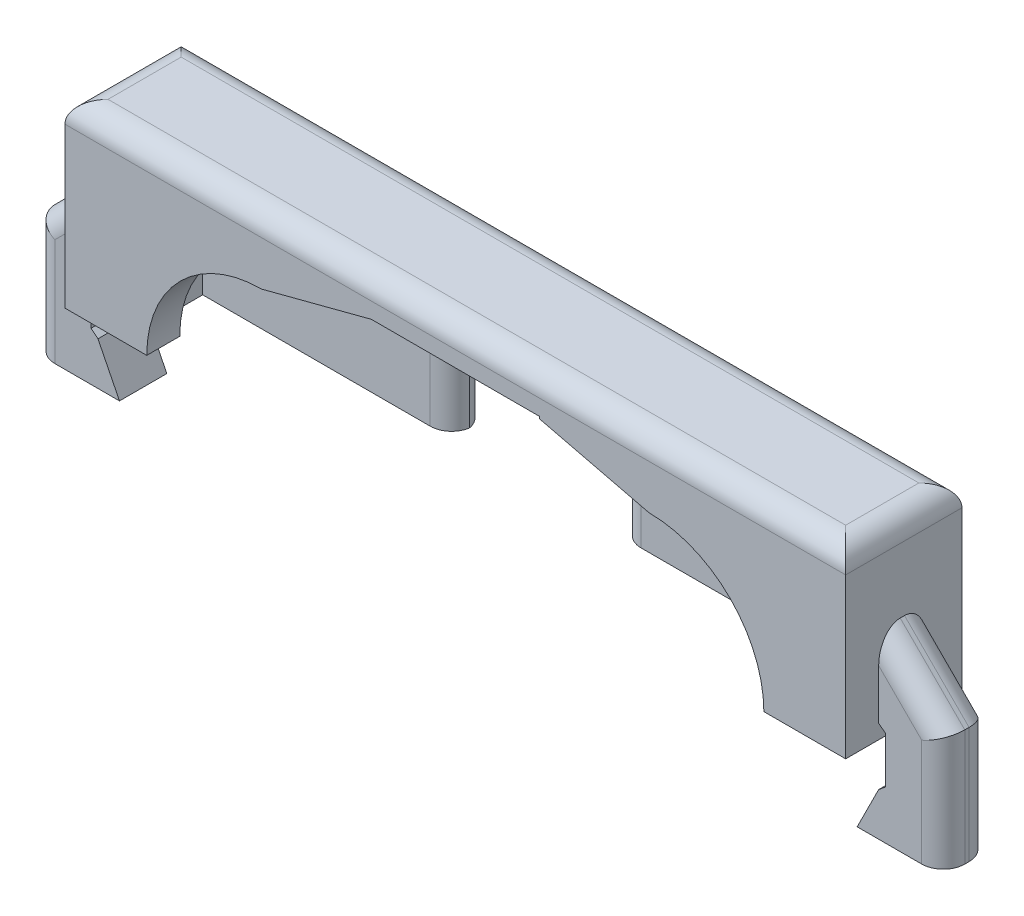
from build123d import *

# Parameters (mm, degrees)
SKETCH1_W           = 54.4
SKETCH1_H           = 8.1
SKETCH1_W_2         = 46.4
SKETCH1_H_2         = 3.3
BOSS_EXTRUDE1_DEPTH = 10
SKETCH2_W           = 11.7
SKETCH2_H           = 20
CUT_EXTRUDE1_DEPTH  = 10
SKETCH3_R           = 8
CUT_EXTRUDE2_DEPTH  = 10
SKETCH4_W           = 54.4
SKETCH4_H           = 8.1
BOSS_EXTRUDE2_DEPTH = 2.6
BOSS_EXTRUDE3_DEPTH = 3.3
SKETCH2_2_W         = 11.7
SKETCH2_2_H         = 20
CUT_EXTRUDE3_DEPTH  = 20
CUT_EXTRUDE4_START  = -5
CUT_EXTRUDE4_DEPTH  = 5
SKETCH7_W           = 2.777966001
SKETCH7_H           = 4.960653573
BOSS_EXTRUDE4_DEPTH = 3.3
FILLET1_R           = 1.5
FILLET2_R           = 1.5
FILLET3_R           = 1.5
FILLET4_R           = 1.5


with BuildPart() as part:
    # Sketch1 → Boss-Extrude1 (new body)
    with BuildSketch(Plane(origin=(0, 0, 0), x_dir=(1, 0, 0), z_dir=(0, 1, 0))):
        Rectangle(SKETCH1_W, SKETCH1_H)
        with Locations((0, -0.1)):
            Rectangle(SKETCH1_W_2, SKETCH1_H_2, mode=Mode.SUBTRACT)
    extrude(amount=BOSS_EXTRUDE1_DEPTH)

    # Sketch2 → Cut-Extrude1 (cut)
    with BuildSketch(Plane.XY.offset(-1.55)):
        Rectangle(SKETCH2_W, SKETCH2_H)
    extrude(amount=-CUT_EXTRUDE1_DEPTH, mode=Mode.SUBTRACT)

    # Sketch3 → Cut-Extrude2 (cut)
    with BuildSketch(Plane(origin=(0, 0, 1.75), x_dir=(-1, 0, 0), z_dir=(0, 0, -1))):
        with Locations((-13.5, 0)):
            Circle(SKETCH3_R)
        with Locations((13.5, 0)):
            Circle(SKETCH3_R)
    extrude(amount=-CUT_EXTRUDE2_DEPTH, mode=Mode.SUBTRACT)

    # Sketch4 → Boss-Extrude2 (add)
    with BuildSketch(Plane(origin=(0, 10, 0), x_dir=(1, 0, 0), z_dir=(0, 1, 0))):
        Rectangle(SKETCH4_W, SKETCH4_H)
    extrude(amount=BOSS_EXTRUDE2_DEPTH)

    # Sketch5 → Boss-Extrude3 (add)
    with BuildSketch(Plane.XY.offset(-1.55)):
        Polygon((27.2, -6), (25.7, -6), (27.2, -3), (29.7, -0.95), (27.2, 1.001976063), (27.2, 6.6), (29.7, 4.1), (31.7, 2.1), (31.7, -6), (29.7, -6), align=None)
        Polygon((-27.2, 6.6), (-27.2, 1.001976063), (-29.7, -0.95), (-27.2, -3), (-25.7, -6), (-27.2, -6), (-29.7, -6), (-31.7, -6), (-31.7, 2.1), (-29.7, 4.1), align=None)
    extrude(amount=BOSS_EXTRUDE3_DEPTH)

    # Sketch2<2> → Cut-Extrude3 (cut)
    with BuildSketch(Plane.XY.offset(-1.55)):
        Rectangle(SKETCH2_2_W, SKETCH2_2_H)
    extrude(amount=CUT_EXTRUDE3_DEPTH, mode=Mode.SUBTRACT)

    # Sketch6 → Cut-Extrude4 (cut)
    with BuildSketch(Plane.XY.offset(4.05).offset(CUT_EXTRUDE4_START)):
        with BuildLine():
            Line((-13.5, 8), (-5.85, 10))
            Line((-5.85, 10), (5.25, 10))
            Line((5.25, 10), (13.5, 8))
            ThreePointArc((13.5, 8), (21.5, 0), (13.5, -8))
            Line((13.5, -8), (-13.5, -8))
            ThreePointArc((-13.5, -8), (-21.5, 0), (-13.5, 8))
        make_face()
    extrude(amount=CUT_EXTRUDE4_DEPTH, mode=Mode.SUBTRACT)

    # Sketch7 → Boss-Extrude4 (add)
    with BuildSketch(Plane.XY.offset(1.75)):
        with Locations((-29.069429935, -1.511833966)):
            Rectangle(SKETCH7_W, SKETCH7_H)
        with Locations((29.069429935, -1.511833966)):
            Rectangle(SKETCH7_W, SKETCH7_H)
    extrude(amount=-BOSS_EXTRUDE4_DEPTH)

    # Fillet1
    fillet1_edges = [part.edges().sort_by_distance(p)[0] for p in [
        (-27.2, 12.6, 0),
        (0, 12.6, 4.05),
        (27.2, 12.6, 0),
        (0, 12.6, -4.05),
    ]]
    fillet(fillet1_edges, radius=FILLET1_R)

    # Fillet2
    # the kernel refuses this fillet: 1.5 mm, written as the material it takes off along each edge
    with BuildSketch(Plane(origin=(5.85, 10, -1.55), x_dir=(1, 0, 0), z_dir=(0, -1, 0))) as fillet2_piece_1:
        with BuildLine():
            CenterArc((FILLET2_R, -FILLET2_R), FILLET2_R, 90, 90)
            Line((0, -FILLET2_R), (0, 0))
            Line((0, 0), (FILLET2_R, 0))
        make_face()
    extrude(amount=13.75, mode=Mode.SUBTRACT)
    with BuildSketch(Plane(origin=(5.85, 10, -4.05), x_dir=(1, 0, 0), z_dir=(0, -1, 0))) as fillet2_piece_2:
        with BuildLine():
            CenterArc((FILLET2_R, FILLET2_R), FILLET2_R, 180, 90)
            Line((0, FILLET2_R), (0, 0))
            Line((0, 0), (FILLET2_R, 0))
        make_face()
    extrude(amount=13.75, mode=Mode.SUBTRACT)

    # Fillet3
    # the kernel refuses this fillet: 1.5 mm, written as the material it takes off along each edge
    with BuildSketch(Plane(origin=(-5.85, -3.75, -1.55), x_dir=(0, 0, -1), z_dir=(0, 1, 0)), Plane(origin=(-5.85, -3.75, -4.05), x_dir=(-1, 0, 0), z_dir=(0, 1, 0))) as fillet3_piece_1:
        with BuildLine():
            CenterArc((FILLET3_R, FILLET3_R), FILLET3_R, 180, 90)
            Line((0, FILLET3_R), (0, 0))
            Line((0, 0), (FILLET3_R, 0))
        make_face()
    extrude(amount=13.75, mode=Mode.SUBTRACT)

    # Fillet4
    fillet4_edges = [part.edges().sort_by_distance(p)[0] for p in [
        (31.7, -1.95, -1.55),
        (29.45, 4.35, -1.55),
        (31.7, -1.95, 1.75),
        (29.45, 4.35, 1.75),
        (-29.45, 4.35, -1.55),
        (-31.7, -1.95, -1.55),
        (-29.45, 4.35, 1.75),
        (-31.7, -1.95, 1.75),
    ]]
    fillet(fillet4_edges, radius=FILLET4_R)


solid = part.part
